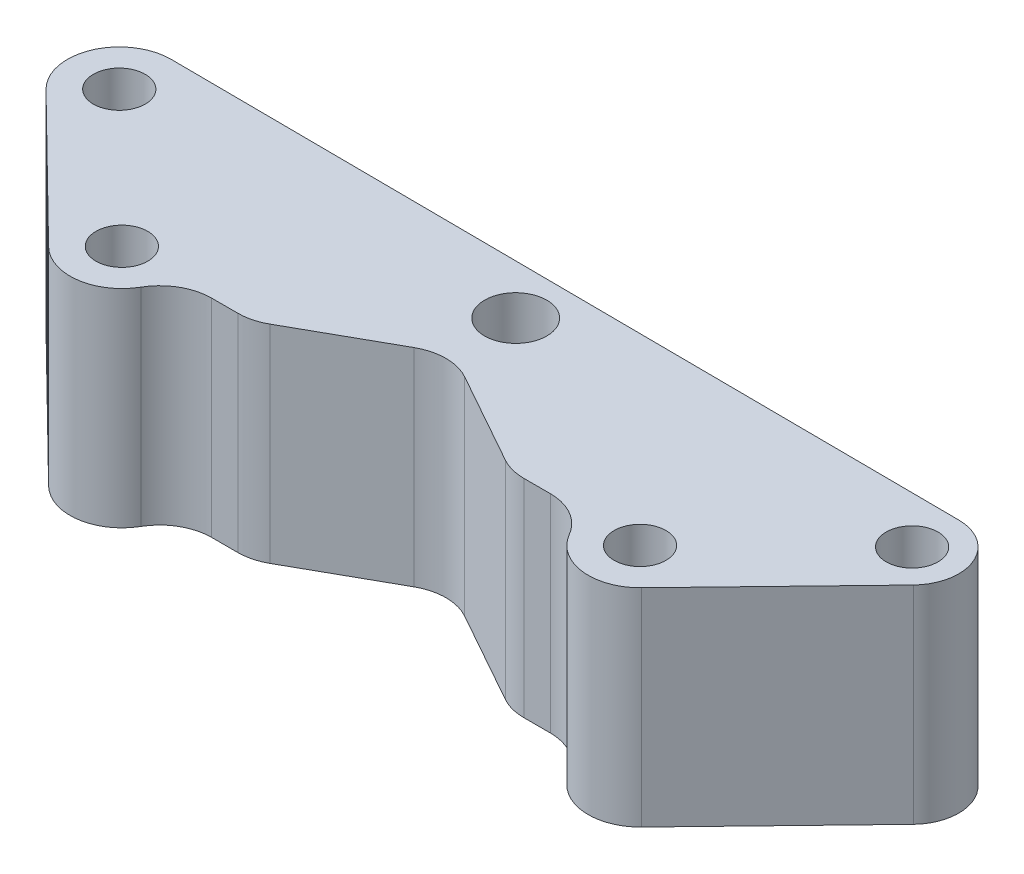
from build123d import *

# Parameters (mm, degrees)
SZKIC1_R                    = 6
SZKIC1_R_2                  = 5
DODANIE_WYCI_GNI_CIE1_DEPTH = 40
SZKIC2_R                    = 11
WYTNIJ_WYCI_GNI_CIE1_DEPTH  = 5
SZKIC3_R                    = 1.25
WYTNIJ_WYCI_GNI_CIE2_DEPTH  = 10
WYTNIJ_WYCI_GNI_CIE3_DEPTH  = 102.873696311
ZAOKR_GLENIE1_R             = 10


with BuildPart() as part:
    # Szkic1 → Dodanie-wyciągnięcie1 (new body)
    with BuildSketch(Plane(origin=(0, 0, 0), x_dir=(1, 0, 0), z_dir=(0, 1, 0))):
        with BuildLine():
            Line((76.55881097, 8.999807846), (-76.5, 10))
            ThreePointArc((-76.5, 10), (-85.756912984, 3.782798171), (-83.503406701, -7.138087599))
            Line((-83.503406701, -7.138087599), (-57.003406701, -33.138087599))
            ThreePointArc((-57.003406701, -33.138087599), (-46.129216295, -35.220468183), (-40, -26))
            Line((-40, -26), (40, -26))
            ThreePointArc((40, -26), (46.253760794, -35.271768537), (57.193138362, -32.946852561))
            Line((57.193138362, -32.946852561), (82.973824526, -6.252167305))
            ThreePointArc((82.973824526, -6.252167305), (84.796054372, 3.489338313), (76.55881097, 8.999807846))
        make_face()
        Circle(SZKIC1_R, mode=Mode.SUBTRACT)
        with Locations((76.5, 0)):
            Circle(SZKIC1_R_2, mode=Mode.SUBTRACT)
        with Locations((50, -26)):
            Circle(SZKIC1_R_2, mode=Mode.SUBTRACT)
        with Locations((-50, -26)):
            Circle(SZKIC1_R_2, mode=Mode.SUBTRACT)
        with Locations((-76.5, 0)):
            Circle(SZKIC1_R_2, mode=Mode.SUBTRACT)
    extrude(amount=DODANIE_WYCI_GNI_CIE1_DEPTH)

    # Szkic2 → Wytnij-wyciągnięcie1 (cut)
    with BuildSketch(Plane.XZ):
        Circle(SZKIC2_R)
    extrude(amount=-WYTNIJ_WYCI_GNI_CIE1_DEPTH, mode=Mode.SUBTRACT)

    # Szkic3 → Wytnij-wyciągnięcie2 (cut)
    with BuildSketch(Plane.XZ.offset(-5)):
        with Locations((-5.656854249, 5.656854249)):
            Circle(SZKIC3_R)
        with Locations((5.656854249, 5.656854249)):
            Circle(SZKIC3_R)
        with Locations((5.656854249, -5.656854249)):
            Circle(SZKIC3_R)
        with Locations((-5.656854249, -5.656854249)):
            Circle(SZKIC3_R)
    extrude(amount=-WYTNIJ_WYCI_GNI_CIE2_DEPTH, mode=Mode.SUBTRACT)

    # Szkic4 → Wytnij-wyciągnięcie3 (cut, through all)
    with BuildSketch(Plane(origin=(0, 40, 0), x_dir=(1, 0, 0), z_dir=(0, 1, 0))):
        Polygon((-25, -26), (0, -12), (25, -26), align=None)
    extrude(amount=-WYTNIJ_WYCI_GNI_CIE3_DEPTH, mode=Mode.SUBTRACT)

    # Zaokrąglenie1
    zaokr_glenie1_edges = [part.edges().sort_by_distance(p)[0] for p in [
        (40, 20, 26),
        (-40, 20, 26),
        (25, 20, 26),
        (0, 20, 12),
        (-25, 20, 26),
    ]]
    fillet(zaokr_glenie1_edges, radius=ZAOKR_GLENIE1_R)


solid = part.part
